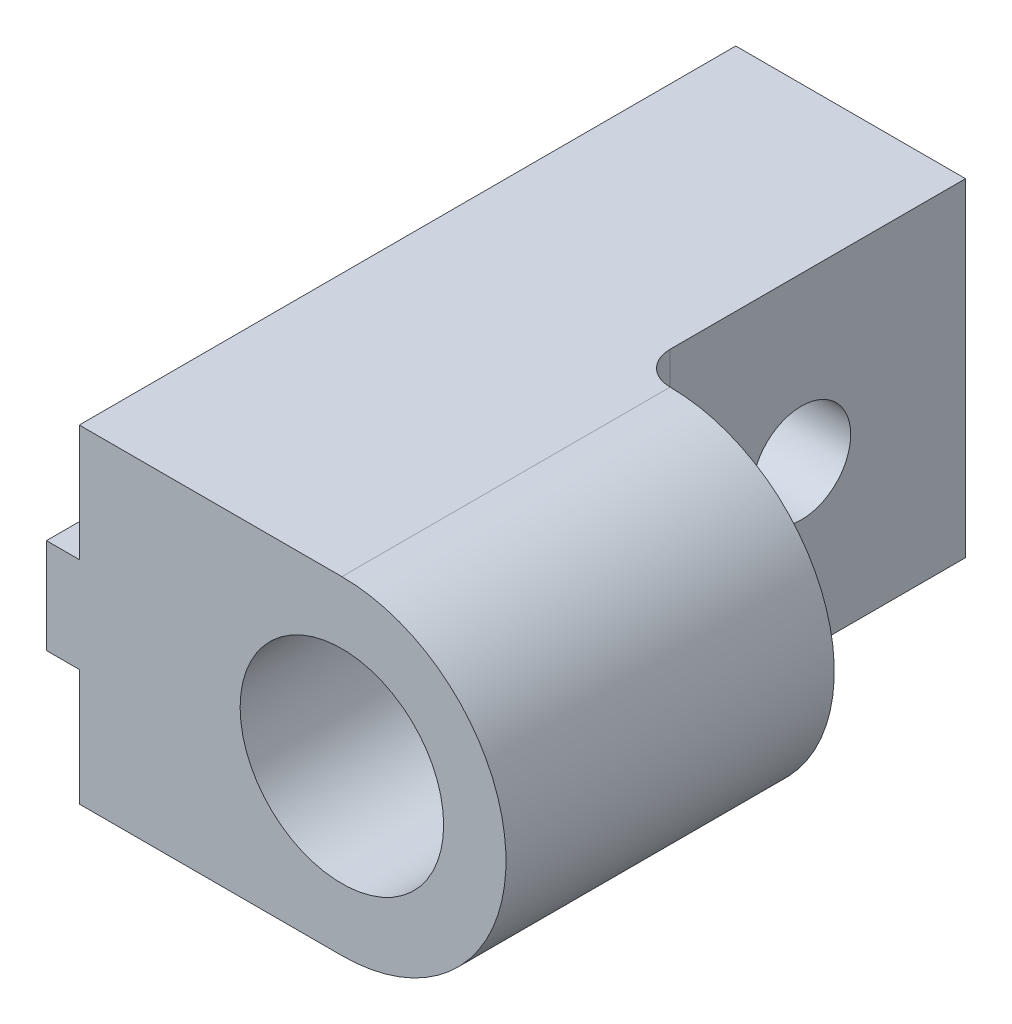
from build123d import *

# Parameters (mm, degrees)
MAIN_DEPTH                     = 20
SKETCH2_R                      = 3.1
SHAFTHOLE_DEPTH                = 5
SKETCH3_W                      = 10
SKETCH3_H                      = 10
MAKERBEAMRECTANGULARHOLE_DEPTH = 23.113344387
SKETCH4_R                      = 1.5
MAKERBEAMHOLE_DEPTH            = 23.113344387
FILLET1_R                      = 1


with BuildPart() as part:
    # Sketch1 → Main (new body)
    with BuildSketch(Plane.XY):
        with BuildLine():
            Line((-8, 5), (-8, 1.45))
            Line((-8, 1.45), (-9, 1.45))
            Line((-9, 1.45), (-9, -1.45))
            Line((-9, -1.45), (-8, -1.45))
            Line((-8, -1.45), (-8, -5))
            Line((-8, -5), (0, -5))
            ThreePointArc((0, -5), (5, 0), (0, 5))
            Line((0, 5), (-8, 5))
        make_face()
    extrude(amount=MAIN_DEPTH)

    # Sketch2 → ShaftHole (cut)
    with BuildSketch(Plane.XY.offset(20)):
        Circle(SKETCH2_R)
    extrude(amount=-SHAFTHOLE_DEPTH, mode=Mode.SUBTRACT)

    # Sketch3 → MakerBeamRectangularHole (cut, through all)
    with BuildSketch(Plane(origin=(-1, 0, 0), x_dir=(0, 0, -1), z_dir=(1, 0, 0))):
        with Locations((-5, 0)):
            Rectangle(SKETCH3_W, SKETCH3_H)
    extrude(amount=MAKERBEAMRECTANGULARHOLE_DEPTH, mode=Mode.SUBTRACT)

    # Sketch4 → MakerBeamHole (cut, through all)
    with BuildSketch(Plane(origin=(-1, 0, 0), x_dir=(0, 0, -1), z_dir=(1, 0, 0))):
        with Locations((-5, 0)):
            Circle(SKETCH4_R)
    extrude(amount=-MAKERBEAMHOLE_DEPTH, mode=Mode.SUBTRACT)

    # Fillet1
    fillet1_edges = [part.edges().sort_by_distance(p)[0] for p in [
        (-1, 0, 10),
    ]]
    fillet(fillet1_edges, radius=FILLET1_R)


solid = part.part
